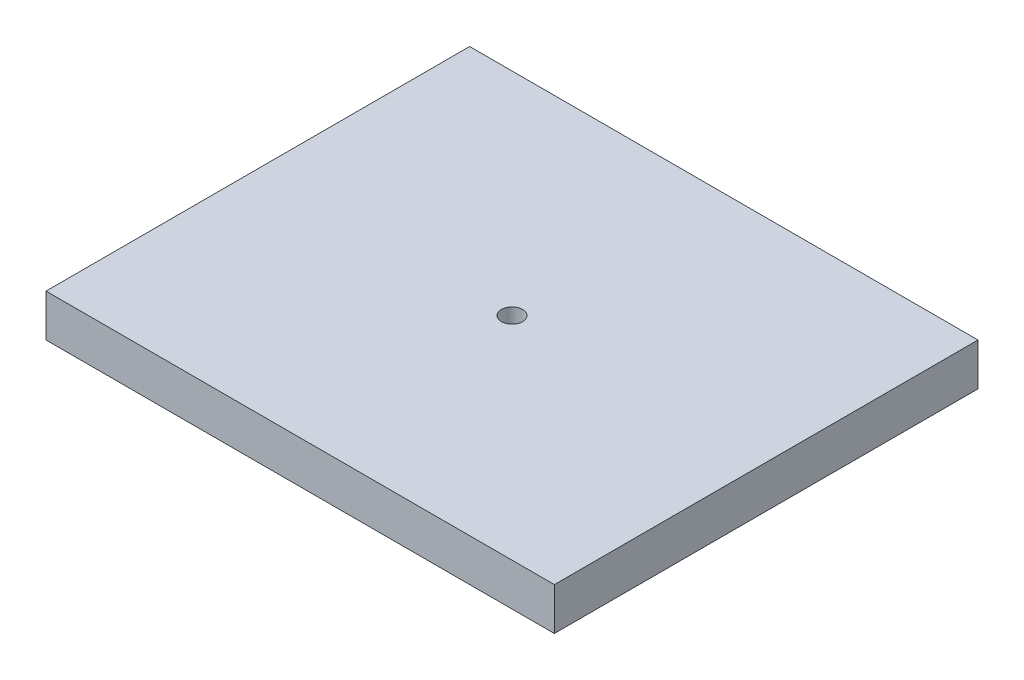
from build123d import *

# Parameters (mm, degrees)
SKETCH1_W           = 240
SKETCH1_H           = 200
BOSS_EXTRUDE1_DEPTH = 10
SKETCH2_R           = 5
CUT_EXTRUDE1_DEPTH  = 158.48015748


with BuildPart() as part:
    # Sketch1 → Boss-Extrude1 (new, symmetric)
    with BuildSketch(Plane(origin=(0, 0, 0), x_dir=(1, 0, 0), z_dir=(0, 1, 0))):
        Rectangle(SKETCH1_W, SKETCH1_H)
    extrude(amount=BOSS_EXTRUDE1_DEPTH, both=True)

    # Sketch2 → Cut-Extrude1 (cut, through all)
    with BuildSketch(Plane(origin=(0, 10, 0), x_dir=(1, 0, 0), z_dir=(0, 1, 0))):
        Circle(SKETCH2_R)
    extrude(amount=-CUT_EXTRUDE1_DEPTH, mode=Mode.SUBTRACT)


solid = part.part
